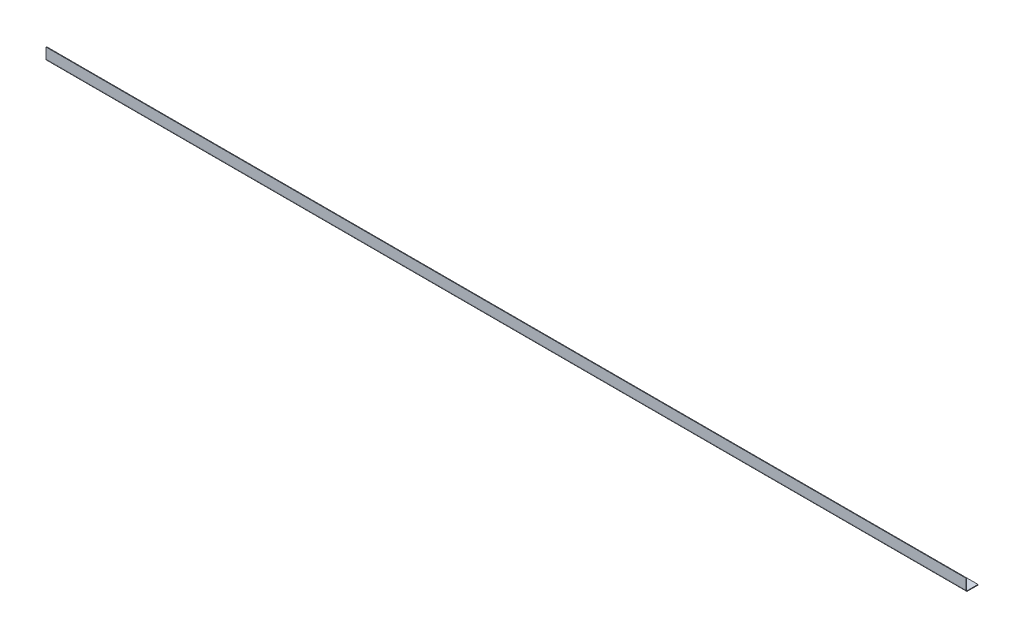
from build123d import *

# Parameters (mm, degrees)
BASE_FLANGE1_DEPTH = 1150


# Sheet-metal steps are written as plain solids
with BuildPart() as part:
    # Sketch1 → Base-Flange1 (new, symmetric)
    with BuildSketch(Plane(origin=(0, 0, 0), x_dir=(0, 0, -1), z_dir=(1, 0, 0))):
        with BuildLine():
            Line((0, 30), (0, 4))
            ThreePointArc((0, 4), (1.171572875, 1.171572875), (4, 0))
            Line((4, 0), (30, 0))
            Line((30, 0), (30, 1.5))
            Line((30, 1.5), (4, 1.5))
            ThreePointArc((4, 1.5), (2.232233047, 2.232233047), (1.5, 4))
            Line((1.5, 4), (1.5, 30))
            Line((1.5, 30), (0, 30))
        make_face()
    extrude(amount=BASE_FLANGE1_DEPTH, both=True)


solid = part.part
